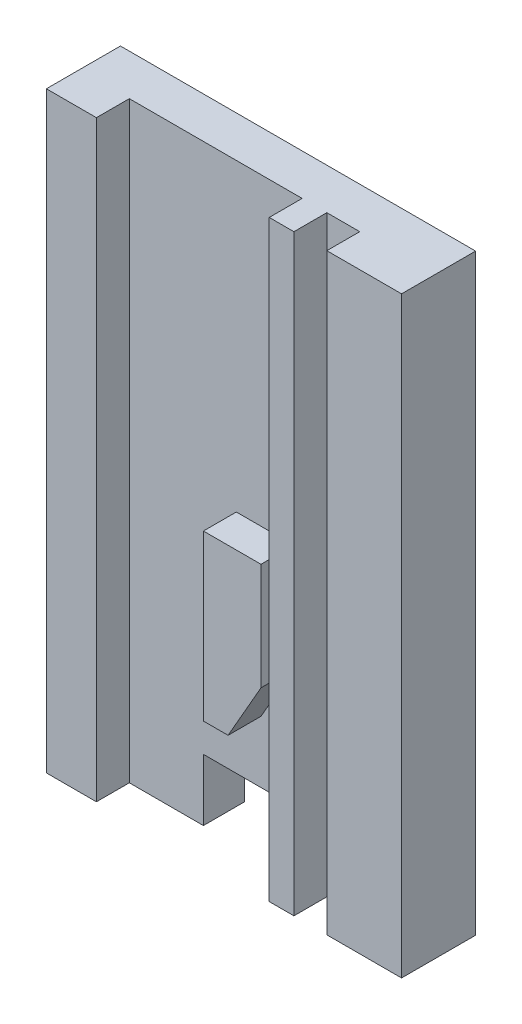
from build123d import *

# Parameters (mm, degrees)
SKETCH1_W           = 43.16
SKETCH1_H           = 72
BOSS_EXTRUDE1_DEPTH = 9
SKETCH2_W           = 37.08
SKETCH2_H           = 4
CUT_EXTRUDE1_DEPTH  = 76.701363264
SKETCH3_W           = 28.08
SKETCH3_H           = 7.5
CUT_EXTRUDE2_DEPTH  = 43.269331672
SKETCH4_W           = 16.08
SKETCH4_H           = 64.5
BOSS_EXTRUDE2_DEPTH = 4
SKETCH5_W           = 16.08
SKETCH5_H           = 9
BOSS_EXTRUDE3_DEPTH = 7.5
SKETCH6_W           = 4
SKETCH6_H           = 4
CUT_EXTRUDE3_DEPTH  = 76.701363264
BOSS_EXTRUDE4_DEPTH = 4


with BuildPart() as part:
    # Sketch1 → Boss-Extrude1 (new body)
    with BuildSketch(Plane(origin=(0, 0, 0), x_dir=(-1, 0, 0), z_dir=(0, 0, -1))):
        Rectangle(SKETCH1_W, SKETCH1_H)
    extrude(amount=-BOSS_EXTRUDE1_DEPTH)

    # Sketch2 → Cut-Extrude1 (cut, through all)
    with BuildSketch(Plane(origin=(0, 36, 0), x_dir=(-1, 0, 0), z_dir=(0, 1, 0))):
        with Locations((-3.04, 7)):
            Rectangle(SKETCH2_W, SKETCH2_H)
    extrude(amount=-CUT_EXTRUDE1_DEPTH, mode=Mode.SUBTRACT)

    # Sketch3 → Cut-Extrude2 (cut, through all)
    with BuildSketch(Plane.XY.offset(5)):
        with Locations((7.54, -32.25)):
            Rectangle(SKETCH3_W, SKETCH3_H)
    extrude(amount=-CUT_EXTRUDE2_DEPTH, mode=Mode.SUBTRACT)

    # Sketch4 → Boss-Extrude2 (add)
    with BuildSketch(Plane.XY.offset(5)):
        with Locations((13.54, 3.75)):
            Rectangle(SKETCH4_W, SKETCH4_H)
    extrude(amount=BOSS_EXTRUDE2_DEPTH)

    # Sketch5 → Boss-Extrude3 (add)
    with BuildSketch(Plane.XZ.offset(28.5)):
        with Locations((13.54, 4.5)):
            Rectangle(SKETCH5_W, SKETCH5_H)
    extrude(amount=BOSS_EXTRUDE3_DEPTH)

    # Sketch6 → Cut-Extrude3 (cut, through all)
    with BuildSketch(Plane(origin=(0, 36, 0), x_dir=(-1, 0, 0), z_dir=(0, 1, 0))):
        with Locations((-10.5, 7)):
            Rectangle(SKETCH6_W, SKETCH6_H)
    extrude(amount=-CUT_EXTRUDE3_DEPTH, mode=Mode.SUBTRACT)

    # Sketch7 → Boss-Extrude4 (add)
    with BuildSketch(Plane.XY.offset(5)):
        Polygon((-2.5, -1), (4.5, -1), (4.5, -14), (0.5, -21), (-2.5, -21), align=None)
    extrude(amount=BOSS_EXTRUDE4_DEPTH)


solid = part.part
